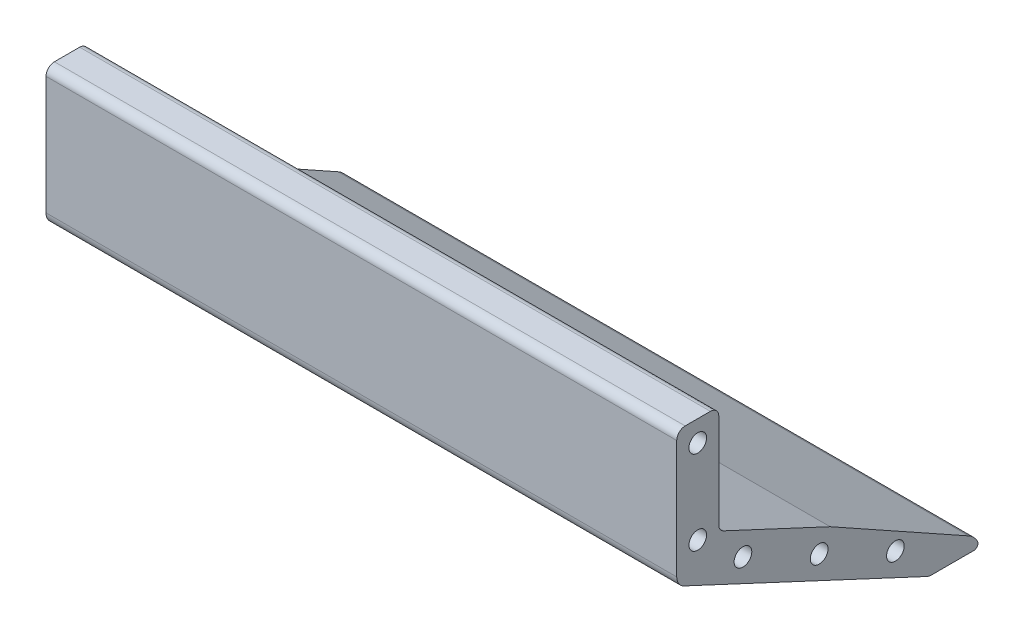
from build123d import *

# Parameters (mm, degrees)
SKETCH_1_R               = 2.1
SKETCH_1_W               = 40.5
SKETCH_1_H               = 20.5
SKETCH_1_R_2             = 6
EXTRUDE_1_DEPTH          = 3
SKETCH_2_R               = 3
SKETCH_2_R_2             = 2.1
CUT_EXTRUDE_1_DEPTH      = 10
SKETCH_3_R               = 1.5
CUT_EXTRUDE_2_DEPTH      = 10
SKETCH_4_R               = 2.1
CUT_EXTRUDE_3_DEPTH      = 10
CHAMFER_1_SIZE           = 10
FILLET_1_R               = 3
FILLET_2_R               = 2
SKETCH_5_R               = 2.1
CUT_EXTRUDE_4_DEPTH      = 10
CUT_EXTRUDE_5_DEPTH      = 10
MOVE_START               = 3
MOVE_FACE_1_OUTLINE_R    = 2.1
MOVE_FACE_1_DEPTH        = 144
FILLET_3_R               = 2
DELETE_START             = -3
DELETE_FACE_1_DEPTH      = 150
DELETE_FACE_2_OUTLINE_R  = 2.1
DELETE_FACE_2_DEPTH      = 150
CUT_EXTRUDE_6_DEPTH      = 177.068168617
CUT_EXTRUDE_6_DEPTH_BACK = 177.068168617
FILLET_4_R               = 5
FILLET_5_R               = 1


# Read off the part's stored shape, not the designer's step: 移动面1, 删除面1, 删除面2
with BuildPart() as part:
    # 草图1 → 凸台-拉伸1 (new, symmetric)
    with BuildSketch(Plane(origin=(0, 0, 0), x_dir=(0, 0, -1), z_dir=(1, 0, 0))):
        with BuildLine():
            Line((-60, -42.021540511), (0, -70))
            Line((0, -70), (12, -70))
            Line((12, -70), (12, 30))
            Line((12, 30), (-75.715728753, 30))
            Line((-75.715728753, 30), (-125.857864376, 80.142135624))
            ThreePointArc((-125.857864376, 80.142135624), (-154.142135624, 80.142135624), (-154.142135624, 51.857864376))
            Line((-154.142135624, 51.857864376), (-92.284271247, -10))
            Line((-92.284271247, -10), (-60, -10))
            Line((-60, -10), (-60, -42.021540511))
        make_face()
        with Locations((-73.77114317, 0.625)):
            Circle(SKETCH_1_R, mode=Mode.SUBTRACT)
        with Locations((-49.02114317, 5.625)):
            Rectangle(SKETCH_1_W, SKETCH_1_H, mode=Mode.SUBTRACT)
        with Locations((-24.27114317, 0.625)):
            Circle(SKETCH_1_R, mode=Mode.SUBTRACT)
        Circle(SKETCH_1_R_2, mode=Mode.SUBTRACT)
        with Locations((-73.77114317, 10.625)):
            Circle(SKETCH_1_R, mode=Mode.SUBTRACT)
        with Locations((-24.27114317, 10.625)):
            Circle(SKETCH_1_R, mode=Mode.SUBTRACT)
    extrude(amount=EXTRUDE_1_DEPTH, both=True)

    # 草图2 → 切除-拉伸1 (cut)
    with BuildSketch(Plane(origin=(3, 0, 0), x_dir=(0, 0, -1), z_dir=(1, 0, 0))):
        with Locations((-140, 66)):
            Circle(SKETCH_2_R)
        with Locations((-140, 82)):
            Circle(SKETCH_2_R_2)
        with Locations((-126.143593539, 74)):
            Circle(SKETCH_2_R_2)
        with Locations((-126.143593539, 58)):
            Circle(SKETCH_2_R_2)
        with Locations((-140, 50)):
            Circle(SKETCH_2_R_2)
        with Locations((-153.856406461, 58)):
            Circle(SKETCH_2_R_2)
        with Locations((-153.856406461, 74)):
            Circle(SKETCH_2_R_2)
    extrude(amount=-CUT_EXTRUDE_1_DEPTH, mode=Mode.SUBTRACT)

    # 草图3 → 切除-拉伸2 (cut)
    with BuildSketch(Plane(origin=(3, 0, 0), x_dir=(0, 0, -1), z_dir=(1, 0, 0))):
        with Locations((-69.27114317, 15.875)):
            Circle(SKETCH_3_R)
        with Locations((-28.77114317, 15.875)):
            Circle(SKETCH_3_R)
        with Locations((-69.27114317, -4.625)):
            Circle(SKETCH_3_R)
        with Locations((-28.77114317, -4.625)):
            Circle(SKETCH_3_R)
    extrude(amount=-CUT_EXTRUDE_2_DEPTH, mode=Mode.SUBTRACT)

    # 草图4 → 切除-拉伸3 (cut)
    with BuildSketch(Plane(origin=(3, 0, 0), x_dir=(0, 0, -1), z_dir=(1, 0, 0))):
        with Locations((-55, -15)):
            Circle(SKETCH_4_R)
        with Locations((-55, -35)):
            Circle(SKETCH_4_R)
        with Locations((7, -65)):
            Circle(SKETCH_4_R)
        with Locations((7, -45)):
            Circle(SKETCH_4_R)
        with Locations((-8, -60.75264914)):
            Circle(SKETCH_4_R)
        with Locations((-26.126155741, -52.300283905)):
            Circle(SKETCH_4_R)
        with Locations((-44.252311481, -43.84791867)):
            Circle(SKETCH_4_R)
    extrude(amount=-CUT_EXTRUDE_3_DEPTH, mode=Mode.SUBTRACT)

    # 倒角1
    chamfer_1_edges = [part.edges().sort_by_distance(p)[0] for p in [
        (0, -10, 60),
    ]]
    chamfer(chamfer_1_edges, length=CHAMFER_1_SIZE)

    # 圆角1
    fillet_1_edges = [part.edges().sort_by_distance(p)[0] for p in [
        (0, -20, 60),
        (0, -10, 70),
        (0, 30, -12),
        (0, -70, -12),
        (0, -70, 0),
        (0, -42.021540511, 60),
        (0, -10, 92.284271247),
        (0, 30, 75.715728753),
    ]]
    fillet(fillet_1_edges, radius=FILLET_1_R)

    # 圆角2
    fillet_2_edges = [part.edges().sort_by_distance(p)[0] for p in [
        (0, 15.875, 30.27114317),
        (0, 14.375, 28.77114317),
        (0, -4.625, 67.77114317),
        (0, -3.125, 69.27114317),
        (0, -4.625, 30.27114317),
        (0, -3.125, 28.77114317),
        (0, 14.375, 69.27114317),
        (0, 15.875, 67.77114317),
    ]]
    fillet(fillet_2_edges, radius=FILLET_2_R)

    # 草图5 → 切除-拉伸4 (cut)
    with BuildSketch(Plane(origin=(3, 0, 0), x_dir=(0, 0, -1), z_dir=(1, 0, 0))):
        with Locations((-110, 57.213203436)):
            Circle(SKETCH_5_R)
        with Locations((-88.786796564, 36)):
            Circle(SKETCH_5_R)
        with Locations((-109.946763354, 14.785654888)):
            Circle(SKETCH_5_R)
        with Locations((-131.214342006, 35.94434337)):
            Circle(SKETCH_5_R)
        with Locations((-62.230447378, 25)):
            Circle(SKETCH_5_R)
        with Locations((-32.230447378, 25)):
            Circle(SKETCH_5_R)
    extrude(amount=-CUT_EXTRUDE_4_DEPTH, mode=Mode.SUBTRACT)

    # 草图6 → 切除-拉伸5 (cut)
    with BuildSketch(Plane(origin=(3, 0, 0), x_dir=(0, 0, -1), z_dir=(1, 0, 0))):
        with BuildLine():
            ThreePointArc((-60.878679656, -19.121320344), (-60.228361402, -20.09459039), (-60, -21.242640687))
            Line((-60, -21.242640687), (-60, -10))
            Line((-60, -10), (-50, -10))
            Line((-50, -10), (-50, -21.242640687))
            Line((-50, -21.242640687), (-50, -35.650837903))
            Line((-50, -35.650837903), (2.216946626, -60))
            Line((2.216946626, -60), (9, -60))
            Line((9, -60), (12, -60))
            Line((12, -60), (12, 27))
            ThreePointArc((12, 27), (11.121320344, 29.121320344), (9, 30))
            Line((9, 30), (-74.473088065, 30))
            ThreePointArc((-74.473088065, 30), (-75.621138363, 30.228361402), (-76.594408409, 30.878679656))
            Line((-76.594408409, 30.878679656), (-125.857864376, 80.142135624))
            ThreePointArc((-125.857864376, 80.142135624), (-154.142135624, 80.142135624), (-154.142135624, 51.857864376))
            Line((-154.142135624, 51.857864376), (-93.162950904, -9.121320344))
            ThreePointArc((-93.162950904, -9.121320344), (-92.189680857, -9.771638598), (-91.04163056, -10))
            Line((-91.04163056, -10), (-71.242640687, -10))
            ThreePointArc((-71.242640687, -10), (-70.09459039, -10.228361402), (-69.121320344, -10.878679656))
            Line((-69.121320344, -10.878679656), (-60.878679656, -19.121320344))
        make_face()
    extrude(amount=-CUT_EXTRUDE_5_DEPTH, mode=Mode.SUBTRACT)

    # Move Face 1 outline → Move Face 1 (add)
    with BuildSketch(Plane.YZ.offset(MOVE_START)):
        with BuildLine():
            Line((-10, 60), (-40.110329728, 60))
            ThreePointArc((-40.110329728, 60), (-41.722228553, 59.530174337), (-42.829253089, 58.267854785))
            Line((-42.829253089, 58.267854785), (-69.718923361, 0.602770797))
            ThreePointArc((-69.718923361, 0.602770797), (-69.928888021, -0.015765146), (-70, -0.665083988))
            Line((-70, -0.665083988), (-70, -9))
            ThreePointArc((-70, -9), (-69.121320344, -11.121320344), (-67, -12))
            Line((-67, -12), (-60, -12))
            Line((-60, -12), (-60, -2.216946626))
            Line((-60, -2.216946626), (-35.650837903, 50))
            Line((-35.650837903, 50), (-10, 50))
            Line((-10, 50), (-10, 60))
        make_face()
        with Locations((-65, -7)):
            Circle(MOVE_FACE_1_OUTLINE_R, mode=Mode.SUBTRACT)
        with Locations((-60.75264914, 8)):
            Circle(MOVE_FACE_1_OUTLINE_R, mode=Mode.SUBTRACT)
        with Locations((-52.300283905, 26.126155741)):
            Circle(MOVE_FACE_1_OUTLINE_R, mode=Mode.SUBTRACT)
        with Locations((-43.84791867, 44.252311481)):
            Circle(MOVE_FACE_1_OUTLINE_R, mode=Mode.SUBTRACT)
        with Locations((-35, 55)):
            Circle(MOVE_FACE_1_OUTLINE_R, mode=Mode.SUBTRACT)
        with Locations((-15, 55)):
            Circle(MOVE_FACE_1_OUTLINE_R, mode=Mode.SUBTRACT)
    extrude(amount=MOVE_FACE_1_DEPTH)

    # 圆角3
    fillet_3_edges = [part.edges().sort_by_distance(p)[0] for p in [
        (72, -60, -12),
        (75, -60, -2.216946626),
        (75, -35.650837903, 50),
        (72, -10, 50),
        (72, -10, 60),
    ]]
    fillet(fillet_3_edges, radius=FILLET_3_R)

    # Delete Face 1 outline → Delete Face 1 (add)
    with BuildSketch(Plane.YZ.offset(DELETE_START)):
        with BuildLine():
            ThreePointArc((-60, -10), (-60.585786438, -11.414213562), (-62, -12))
            Line((-62, -12), (-60, -12))
            Line((-60, -12), (-60, -10))
        make_face()
        with BuildLine():
            Line((-70, -9), (-70, -12))
            Line((-70, -12), (-67, -12))
            ThreePointArc((-67, -12), (-69.121320344, -11.121320344), (-70, -9))
        make_face()
    extrude(amount=DELETE_FACE_1_DEPTH)

    # Delete Face 2 outline → Delete Face 2 (add)
    with BuildSketch(Plane.YZ.offset(DELETE_START)):
        with Locations((-65, -7)):
            Circle(DELETE_FACE_2_OUTLINE_R)
    extrude(amount=DELETE_FACE_2_DEPTH)

    # 草图8 → 切除-拉伸6 (cut, two sides: drawn at the far end of the back side and taken through both)
    with BuildSketch(Plane(origin=(147, 0, 0), x_dir=(0, 0, -1), z_dir=(1, 0, 0)).offset(-CUT_EXTRUDE_6_DEPTH_BACK)):
        with BuildLine():
            Line((-23.515068548, -48.000964265), (12, -67.8))
            Line((12, -67.8), (12, -60))
            Line((12, -60), (2.660335952, -60))
            ThreePointArc((2.660335952, -60), (2.227456724, -59.952592014), (1.815099428, -59.812615574))
            Line((1.815099428, -59.812615574), (-23.515068548, -48.000964265))
        make_face()
    extrude(amount=CUT_EXTRUDE_6_DEPTH + CUT_EXTRUDE_6_DEPTH_BACK, mode=Mode.SUBTRACT)

    # 圆角4
    # the kernel refuses this fillet: 5 mm, written as the material it takes off along each edge
    with BuildSketch(Plane(origin=(-10.171790934, -67.8, -12), x_dir=(0, 0.4869286506241587, 0.8734417491746865), z_dir=(1, 0, 0))) as fillet_4_piece_1:
        with BuildLine():
            CenterArc((2.868716374, 5), FILLET_4_R, 218.001756319, 51.998243681)
            Line((-1.071243031, 1.921571848), (-1.150042219, 1.860003285))
            ThreePointArc((-1.150042219, 1.860003285), (-0.622965691, 0.912093059), (-0.087344175, -0.048692865))
            Line((-0.087344175, -0.048692865), (0, -0.1))
            Line((0, -0.1), (2.868716374, -0.1))
            Line((2.868716374, -0.1), (2.868716374, 0))
        make_face()
    extrude(amount=164.343581869, mode=Mode.SUBTRACT)

    # 圆角5
    fillet_5_edges = [part.edges().sort_by_distance(p)[0] for p in [
        (72, -70, -12),
    ]]
    fillet(fillet_5_edges, radius=FILLET_5_R)


solid = part.part
